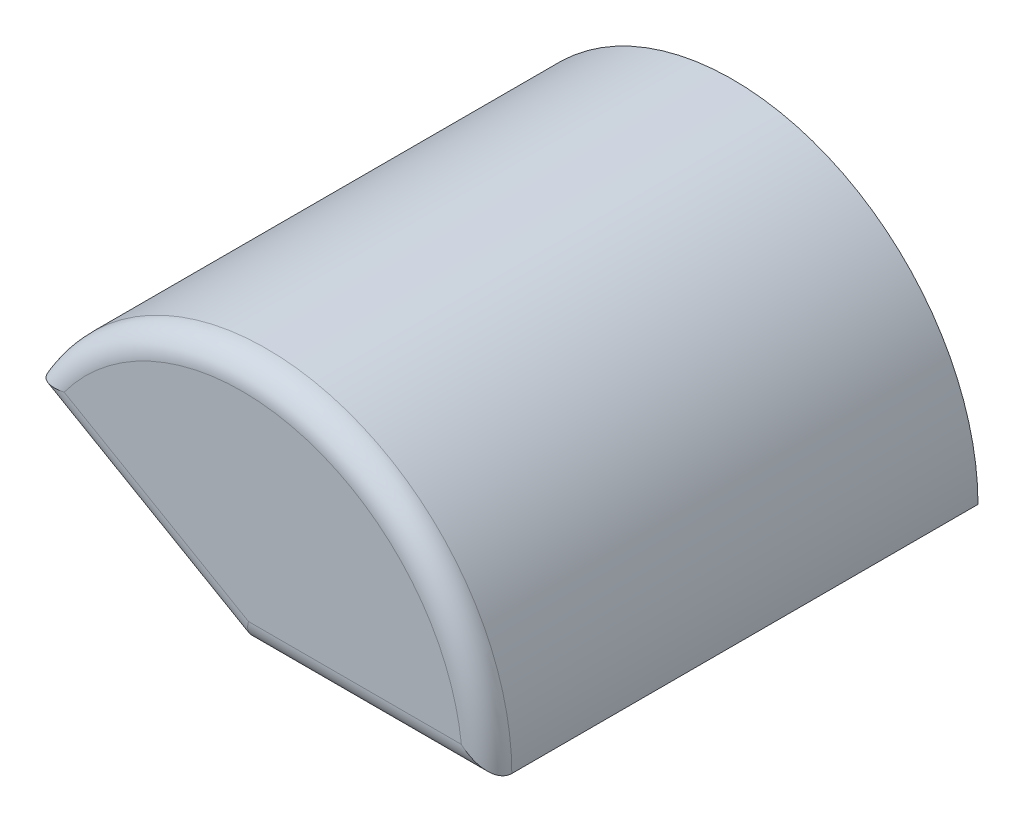
from build123d import *

# Parameters (mm, degrees)
BOSS_EXTRUDE1_DEPTH = 20
FILLET1_R           = 1


with BuildPart() as part:
    # Sketch1 → Boss-Extrude1 (new body)
    with BuildSketch(Plane.XY):
        with BuildLine():
            Line((-8.660254038, 5), (0, 0))
            Line((0, 0), (10, 0))
            ThreePointArc((10, 0), (2.588190451, 9.659258263), (-8.660254038, 5))
        make_face()
    extrude(amount=BOSS_EXTRUDE1_DEPTH)

    # Fillet1
    fillet1_edges = [part.edges().sort_by_distance(p)[0] for p in [
        (-4.330127019, 2.5, 20),
        (2.588190451, 9.659258263, 20),
        (5, 0, 20),
    ]]
    fillet(fillet1_edges, radius=FILLET1_R)


solid = part.part
